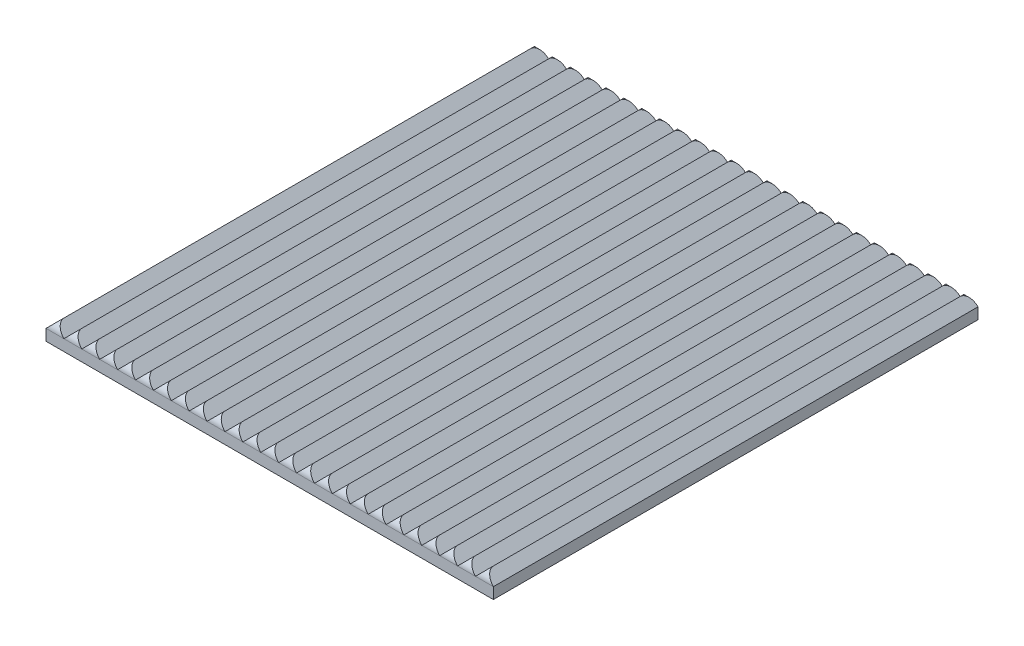
from build123d import *

# Parameters (mm, degrees)
SKETCH1_W               = 60
SKETCH1_H               = 65
SKETCH1_W_2             = 55
SKETCH1_H_2             = 60
BOSS_EXTRUDE1_DEPTH     = 40
SKETCH2_W               = 60
SKETCH2_H               = 65
BOSS_EXTRUDE2_DEPTH     = 2.5
BOSS_EXTRUDE3_DEPTH     = 65
CUT_EXTRUDE1_REACH      = 83.03
CUT_EXTRUDE2_DEPTH      = 84.873058845
CUT_EXTRUDE2_DEPTH_BACK = 84.873058845
SKETCH5_W               = 60
SKETCH5_H               = 41
SNAP_START              = -17.466738465
SNAP_HOOK1_DEPTH        = 0.923076923
SNAP_START_2            = -1.762465991
SNAP_HOOK1_2_DEPTH      = 3.524931982
SNAP_START_3            = -1.989936516
SNAP_HOOK1_3_DEPTH      = 3.979873032
SNAP_START_4            = -19
SNAP_HOOK1_4_DEPTH      = 5


with BuildPart() as part:
    # Sketch1 → Boss-Extrude1 (new body)
    with BuildSketch(Plane(origin=(0, 0, 0), x_dir=(1, 0, 0), z_dir=(0, 1, 0))):
        Rectangle(SKETCH1_W, SKETCH1_H)
        Rectangle(SKETCH1_W_2, SKETCH1_H_2, mode=Mode.SUBTRACT)
    extrude(amount=BOSS_EXTRUDE1_DEPTH)

    # Sketch2 → Boss-Extrude2 (add)
    with BuildSketch(Plane(origin=(0, 40, 0), x_dir=(1, 0, 0), z_dir=(0, 1, 0))):
        Rectangle(SKETCH2_W, SKETCH2_H)
    extrude(amount=BOSS_EXTRUDE2_DEPTH)

    # Sketch3 → Boss-Extrude3 (add)
    with BuildSketch(Plane(origin=(0, 0, -32.5), x_dir=(-1, 0, 0), z_dir=(0, 0, -1))):
        Polygon((-30, 42.5), (-28.8, 43.7), (-27.6, 42.5), (-26.4, 43.7), (-25.2, 42.5), (-24, 43.7), (-22.8, 42.5), (-21.6, 43.7), (-20.4, 42.5), (-19.2, 43.7), (-18, 42.5), (-16.8, 43.7), (-15.6, 42.5), (-14.4, 43.7), (-13.2, 42.5), (-12, 43.7), (-10.8, 42.5), (-9.6, 43.7), (-8.4, 42.5), (-7.2, 43.7), (-6, 42.5), (-4.8, 43.7), (-3.6, 42.5), (-2.4, 43.7), (-1.2, 42.5), (0, 43.7), (1.2, 42.5), (2.4, 43.7), (3.6, 42.5), (4.8, 43.7), (6, 42.5), (7.2, 43.7), (8.4, 42.5), (9.6, 43.7), (10.8, 42.5), (12, 43.7), (13.2, 42.5), (14.4, 43.7), (15.6, 42.5), (16.8, 43.7), (18, 42.5), (19.2, 43.7), (20.4, 42.5), (21.6, 43.7), (22.8, 42.5), (24, 43.7), (25.2, 42.5), (26.4, 43.7), (27.6, 42.5), (28.8, 43.7), (30, 42.5), (30, 42.170064374), (-30, 42.170064374), align=None)
    extrude(amount=-BOSS_EXTRUDE3_DEPTH)

    # Cut-Extrude1: up to this face of the body (flat: up to its plane)
    cut_extrude1_end = Plane(part.part.faces().sort_by_distance((30, 21.25, 0))[0])
    # Sketch4 → Cut-Extrude1 (cut, up to the picked face)
    with BuildSketch(Plane.ZY.offset(30), mode=Mode.PRIVATE) as cut_extrude1_sk1:
        with BuildLine():
            Line((-32.5, 42.5), (-32.5, 43.7))
            Line((-32.5, 43.7), (-31.3, 43.7))
            ThreePointArc((-31.3, 43.7), (-32.148528137, 43.348528137), (-32.5, 42.5))
        make_face()
    cut_extrude1_tool1 = split(extrude(cut_extrude1_sk1.sketch, amount=-CUT_EXTRUDE1_REACH, mode=Mode.PRIVATE), bisect_by=cut_extrude1_end, keep=Keep.BOTH, mode=Mode.PRIVATE)
    cut_extrude1 = cut_extrude1_tool1.solids().sort_by(Axis((-30, 43.431958, -32.231958), (1, 0, 0)))[0]
    add(cut_extrude1, mode=Mode.SUBTRACT)

    # Mirror1: Cut-Extrude1 across plane
    add(cut_extrude1.mirror(Plane.XY), mode=Mode.SUBTRACT)

    # Sketch5 → Cut-Extrude2 (cut, two sides: drawn at the far end of the back side and taken through both)
    with BuildSketch(Plane.XY.offset(32.5).offset(-CUT_EXTRUDE2_DEPTH_BACK)):
        with Locations((0, 20.5)):
            Rectangle(SKETCH5_W, SKETCH5_H)
    extrude(amount=CUT_EXTRUDE2_DEPTH + CUT_EXTRUDE2_DEPTH_BACK, mode=Mode.SUBTRACT)

    # Snap Hook1: read off the stored shape, not the designer's step
    # Snap Hook1 outline → Snap Hook1 (add)
    with BuildSketch(Plane.XY.offset(SNAP_START)):
        Polygon((-1.5, 35.4), (1.5, 35.4), (1.989936516, 41), (-1.989936516, 41), align=None)
    snap_hook1 = extrude(amount=SNAP_HOOK1_DEPTH)

    # Snap Hook1 2 outline → Snap Hook1 2 (add)
    with BuildSketch(Plane.YZ.offset(SNAP_START_2)):
        Polygon((38.4, -17.466738465), (35.4, -17.466738465), (37.9, -18.466738465), (38.4, -18.466738465), align=None)
        Polygon((35.4, -16.543661542), (41, -16.543661542), (41, -15.466738465), align=None)
    snap_hook1_2 = extrude(amount=SNAP_HOOK1_2_DEPTH)

    # Snap Hook1 3 outline → Snap Hook1 3 (add)
    with BuildSketch(Plane.YZ.offset(SNAP_START_3)):
        Polygon((35.4, -16.543661542), (41, -16.543661542), (41, -15.466738465), align=None)
    snap_hook1_3 = extrude(amount=SNAP_HOOK1_3_DEPTH)

    # Snap Hook1 4 outline → Snap Hook1 4 (cut)
    with BuildSketch(Plane.XY.offset(SNAP_START_4)):
        Polygon((-1.989936516, 41), (-1.989936516, 34), (-1.377515871, 34), align=None)
        Polygon((1.377515871, 34), (1.989936516, 34), (1.989936516, 41), align=None)
    snap_hook1_4 = extrude(amount=SNAP_HOOK1_4_DEPTH, mode=Mode.SUBTRACT)

    # Mirror2: Snap Hook1, Snap Hook1 2, Snap Hook1 3, Snap Hook1 4 across plane
    add(snap_hook1.mirror(Plane.XY))
    add(snap_hook1_2.mirror(Plane.XY))
    add(snap_hook1_3.mirror(Plane.XY))
    add(snap_hook1_4.mirror(Plane.XY), mode=Mode.SUBTRACT)


solid = part.part
